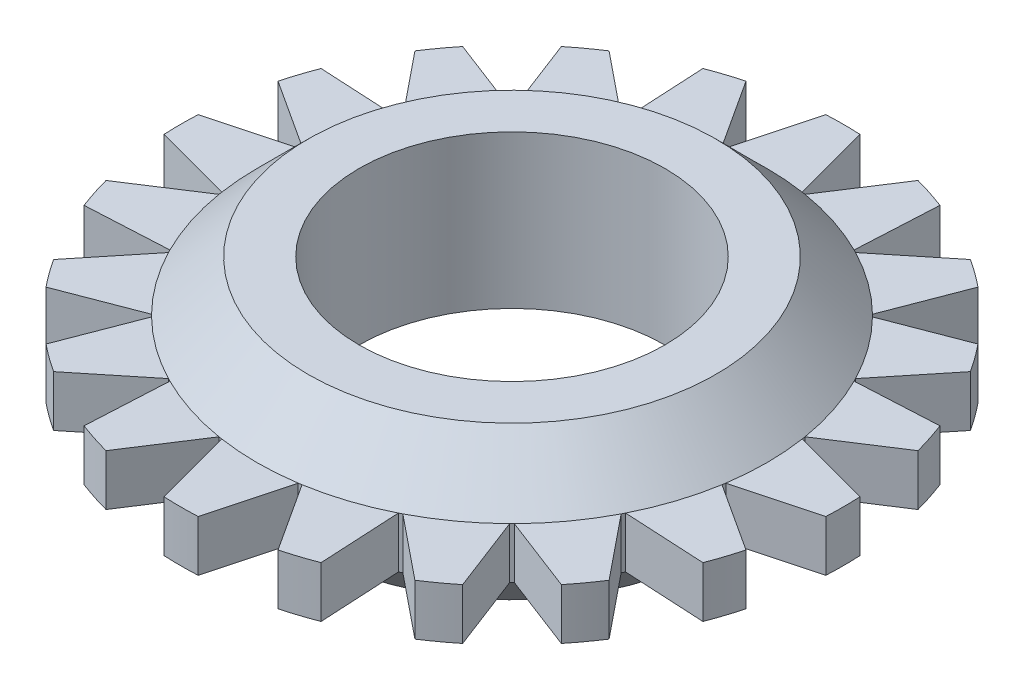
from build123d import *

# Parameters (mm, degrees)
EXTRUDE_1_DEPTH    = 5
EXTRUDE_1_2_DEPTH  = 5
EXTRUDE_1_3_DEPTH  = 5
EXTRUDE_1_4_DEPTH  = 5
EXTRUDE_1_5_DEPTH  = 5
EXTRUDE_1_6_DEPTH  = 5
EXTRUDE_1_7_DEPTH  = 5
EXTRUDE_1_8_DEPTH  = 5
EXTRUDE_1_9_DEPTH  = 5
EXTRUDE_1_10_DEPTH = 5
EXTRUDE_1_11_DEPTH = 5
EXTRUDE_1_12_DEPTH = 5
EXTRUDE_1_13_DEPTH = 5
EXTRUDE_1_14_DEPTH = 5
EXTRUDE_1_15_DEPTH = 5
EXTRUDE_1_16_DEPTH = 5
EXTRUDE_1_17_DEPTH = 5
EXTRUDE_1_18_DEPTH = 5
EXTRUDE_1_19_DEPTH = 5
EXTRUDE_1_20_DEPTH = 5
SKETCH_2_R         = 50
SKETCH_2_R_2       = 30
EXTRUDE_2_DEPTH    = 15
CHAMFER_1_SIZE     = 10


with BuildPart() as part:
    # 草图1 → 凸台-拉伸1 (new, symmetric)
    with BuildSketch(Plane(origin=(0, 0, 0), x_dir=(1, 0, 0), z_dir=(0, 1, 0))):
        with BuildLine():
            Line((-3.352362501, 64.91349371), (-7.5, 49.434299833))
            ThreePointArc((-7.5, 49.434299833), (0, 50), (7.5, 49.434299833))
            Line((7.5, 49.434299833), (3.352362501, 64.91349371))
            ThreePointArc((3.352362501, 64.91349371), (0, 65), (-3.352362501, 64.91349371))
        make_face()
    extrude(amount=EXTRUDE_1_DEPTH, both=True)



with BuildPart() as body_2:
    # 草图1 → Extrude 1 2 (new, symmetric)
    with BuildSketch(Plane(origin=(0, 0, 0), x_dir=(1, 0, 0), z_dir=(0, 1, 0))):
        with BuildLine():
            Line((16.871086519, 62.772338173), (8.143114881, 49.332440443))
            ThreePointArc((8.143114881, 49.332440443), (15.450849719, 47.552825815), (22.408962626, 44.697185527))
            Line((22.408962626, 44.697185527), (23.247658922, 60.700464204))
            ThreePointArc((23.247658922, 60.700464204), (20.086104634, 61.818673559), (16.871086519, 62.772338173))
        make_face()
    extrude(amount=EXTRUDE_1_2_DEPTH, both=True)


with BuildPart() as body_3:
    # 草图1 → Extrude 1 3 (new, symmetric)
    with BuildSketch(Plane(origin=(0, 0, 0), x_dir=(1, 0, 0), z_dir=(0, 1, 0))):
        with BuildLine():
            Line((35.443076043, 54.486588814), (22.989124942, 44.401578062))
            ThreePointArc((22.989124942, 44.401578062), (29.389262615, 40.450849719), (35.124379857, 35.584799278))
            Line((35.124379857, 35.584799278), (40.867312512, 50.545650337))
            ThreePointArc((40.867312512, 50.545650337), (38.206041399, 52.586104634), (35.443076043, 54.486588814))
        make_face()
    extrude(amount=EXTRUDE_1_3_DEPTH, both=True)


with BuildPart() as body_4:
    # 草图1 → Extrude 1 4 (new, symmetric)
    with BuildSketch(Plane(origin=(0, 0, 0), x_dir=(1, 0, 0), z_dir=(0, 1, 0))):
        with BuildLine():
            Line((50.545650337, 40.867312512), (35.584799278, 35.124379857))
            ThreePointArc((35.584799278, 35.124379857), (40.450849719, 29.389262615), (44.401578062, 22.989124942))
            Line((44.401578062, 22.989124942), (54.486588814, 35.443076043))
            ThreePointArc((54.486588814, 35.443076043), (52.586104634, 38.206041399), (50.545650337, 40.867312512))
        make_face()
    extrude(amount=EXTRUDE_1_4_DEPTH, both=True)


with BuildPart() as body_5:
    # 草图1 → Extrude 1 5 (new, symmetric)
    with BuildSketch(Plane(origin=(0, 0, 0), x_dir=(1, 0, 0), z_dir=(0, 1, 0))):
        with BuildLine():
            Line((60.700464204, 23.247658922), (44.697185527, 22.408962626))
            ThreePointArc((44.697185527, 22.408962626), (47.552825815, 15.450849719), (49.332440443, 8.143114881))
            Line((49.332440443, 8.143114881), (62.772338173, 16.871086519))
            ThreePointArc((62.772338173, 16.871086519), (61.818673559, 20.086104634), (60.700464204, 23.247658922))
        make_face()
    extrude(amount=EXTRUDE_1_5_DEPTH, both=True)


with BuildPart() as body_6:
    # 草图1 → Extrude 1 6 (new, symmetric)
    with BuildSketch(Plane(origin=(0, 0, 0), x_dir=(1, 0, 0), z_dir=(0, 1, 0))):
        with BuildLine():
            Line((64.91349371, 3.352362501), (49.434299833, 7.5))
            ThreePointArc((49.434299833, 7.5), (50, 0), (49.434299833, -7.5))
            Line((49.434299833, -7.5), (64.91349371, -3.352362501))
            ThreePointArc((64.91349371, -3.352362501), (65, 0), (64.91349371, 3.352362501))
        make_face()
    extrude(amount=EXTRUDE_1_6_DEPTH, both=True)


with BuildPart() as body_7:
    # 草图1 → Extrude 1 7 (new, symmetric)
    with BuildSketch(Plane(origin=(0, 0, 0), x_dir=(1, 0, 0), z_dir=(0, 1, 0))):
        with BuildLine():
            Line((62.772338173, -16.871086519), (49.332440443, -8.143114881))
            ThreePointArc((49.332440443, -8.143114881), (47.552825815, -15.450849719), (44.697185527, -22.408962626))
            Line((44.697185527, -22.408962626), (60.700464204, -23.247658922))
            ThreePointArc((60.700464204, -23.247658922), (61.818673559, -20.086104634), (62.772338173, -16.871086519))
        make_face()
    extrude(amount=EXTRUDE_1_7_DEPTH, both=True)


with BuildPart() as body_8:
    # 草图1 → Extrude 1 8 (new, symmetric)
    with BuildSketch(Plane(origin=(0, 0, 0), x_dir=(1, 0, 0), z_dir=(0, 1, 0))):
        with BuildLine():
            Line((54.486588814, -35.443076043), (44.401578062, -22.989124942))
            ThreePointArc((44.401578062, -22.989124942), (40.450849719, -29.389262615), (35.584799278, -35.124379857))
            Line((35.584799278, -35.124379857), (50.545650337, -40.867312512))
            ThreePointArc((50.545650337, -40.867312512), (52.586104634, -38.206041399), (54.486588814, -35.443076043))
        make_face()
    extrude(amount=EXTRUDE_1_8_DEPTH, both=True)


with BuildPart() as body_9:
    # 草图1 → Extrude 1 9 (new, symmetric)
    with BuildSketch(Plane(origin=(0, 0, 0), x_dir=(1, 0, 0), z_dir=(0, 1, 0))):
        with BuildLine():
            Line((40.867312512, -50.545650337), (35.124379857, -35.584799278))
            ThreePointArc((35.124379857, -35.584799278), (29.389262615, -40.450849719), (22.989124942, -44.401578062))
            Line((22.989124942, -44.401578062), (35.443076043, -54.486588814))
            ThreePointArc((35.443076043, -54.486588814), (38.206041399, -52.586104634), (40.867312512, -50.545650337))
        make_face()
    extrude(amount=EXTRUDE_1_9_DEPTH, both=True)


with BuildPart() as body_10:
    # 草图1 → Extrude 1 10 (new, symmetric)
    with BuildSketch(Plane(origin=(0, 0, 0), x_dir=(1, 0, 0), z_dir=(0, 1, 0))):
        with BuildLine():
            Line((23.247658922, -60.700464204), (22.408962626, -44.697185527))
            ThreePointArc((22.408962626, -44.697185527), (15.450849719, -47.552825815), (8.143114881, -49.332440443))
            Line((8.143114881, -49.332440443), (16.871086519, -62.772338173))
            ThreePointArc((16.871086519, -62.772338173), (20.086104634, -61.818673559), (23.247658922, -60.700464204))
        make_face()
    extrude(amount=EXTRUDE_1_10_DEPTH, both=True)


with BuildPart() as body_11:
    # 草图1 → Extrude 1 11 (new, symmetric)
    with BuildSketch(Plane(origin=(0, 0, 0), x_dir=(1, 0, 0), z_dir=(0, 1, 0))):
        with BuildLine():
            Line((3.352362501, -64.91349371), (7.5, -49.434299833))
            ThreePointArc((7.5, -49.434299833), (0, -50), (-7.5, -49.434299833))
            Line((-7.5, -49.434299833), (-3.352362501, -64.91349371))
            ThreePointArc((-3.352362501, -64.91349371), (0, -65), (3.352362501, -64.91349371))
        make_face()
    extrude(amount=EXTRUDE_1_11_DEPTH, both=True)


with BuildPart() as body_12:
    # 草图1 → Extrude 1 12 (new, symmetric)
    with BuildSketch(Plane(origin=(0, 0, 0), x_dir=(1, 0, 0), z_dir=(0, 1, 0))):
        with BuildLine():
            Line((-16.871086519, -62.772338173), (-8.143114881, -49.332440443))
            ThreePointArc((-8.143114881, -49.332440443), (-15.450849719, -47.552825815), (-22.408962626, -44.697185527))
            Line((-22.408962626, -44.697185527), (-23.247658922, -60.700464204))
            ThreePointArc((-23.247658922, -60.700464204), (-20.086104634, -61.818673559), (-16.871086519, -62.772338173))
        make_face()
    extrude(amount=EXTRUDE_1_12_DEPTH, both=True)


with BuildPart() as body_13:
    # 草图1 → Extrude 1 13 (new, symmetric)
    with BuildSketch(Plane(origin=(0, 0, 0), x_dir=(1, 0, 0), z_dir=(0, 1, 0))):
        with BuildLine():
            Line((-35.443076043, -54.486588814), (-22.989124942, -44.401578062))
            ThreePointArc((-22.989124942, -44.401578062), (-29.389262615, -40.450849719), (-35.124379857, -35.584799278))
            Line((-35.124379857, -35.584799278), (-40.867312512, -50.545650337))
            ThreePointArc((-40.867312512, -50.545650337), (-38.206041399, -52.586104634), (-35.443076043, -54.486588814))
        make_face()
    extrude(amount=EXTRUDE_1_13_DEPTH, both=True)


with BuildPart() as body_14:
    # 草图1 → Extrude 1 14 (new, symmetric)
    with BuildSketch(Plane(origin=(0, 0, 0), x_dir=(1, 0, 0), z_dir=(0, 1, 0))):
        with BuildLine():
            Line((-50.545650337, -40.867312512), (-35.584799278, -35.124379857))
            ThreePointArc((-35.584799278, -35.124379857), (-40.450849719, -29.389262615), (-44.401578062, -22.989124942))
            Line((-44.401578062, -22.989124942), (-54.486588814, -35.443076043))
            ThreePointArc((-54.486588814, -35.443076043), (-52.586104634, -38.206041399), (-50.545650337, -40.867312512))
        make_face()
    extrude(amount=EXTRUDE_1_14_DEPTH, both=True)


with BuildPart() as body_15:
    # 草图1 → Extrude 1 15 (new, symmetric)
    with BuildSketch(Plane(origin=(0, 0, 0), x_dir=(1, 0, 0), z_dir=(0, 1, 0))):
        with BuildLine():
            Line((-60.700464204, -23.247658922), (-44.697185527, -22.408962626))
            ThreePointArc((-44.697185527, -22.408962626), (-47.552825815, -15.450849719), (-49.332440443, -8.143114881))
            Line((-49.332440443, -8.143114881), (-62.772338173, -16.871086519))
            ThreePointArc((-62.772338173, -16.871086519), (-61.818673559, -20.086104634), (-60.700464204, -23.247658922))
        make_face()
    extrude(amount=EXTRUDE_1_15_DEPTH, both=True)


with BuildPart() as body_16:
    # 草图1 → Extrude 1 16 (new, symmetric)
    with BuildSketch(Plane(origin=(0, 0, 0), x_dir=(1, 0, 0), z_dir=(0, 1, 0))):
        with BuildLine():
            Line((-64.91349371, -3.352362501), (-49.434299833, -7.5))
            ThreePointArc((-49.434299833, -7.5), (-50, 0), (-49.434299833, 7.5))
            Line((-49.434299833, 7.5), (-64.91349371, 3.352362501))
            ThreePointArc((-64.91349371, 3.352362501), (-65, 0), (-64.91349371, -3.352362501))
        make_face()
    extrude(amount=EXTRUDE_1_16_DEPTH, both=True)


with BuildPart() as body_17:
    # 草图1 → Extrude 1 17 (new, symmetric)
    with BuildSketch(Plane(origin=(0, 0, 0), x_dir=(1, 0, 0), z_dir=(0, 1, 0))):
        with BuildLine():
            Line((-62.772338173, 16.871086519), (-49.332440443, 8.143114881))
            ThreePointArc((-49.332440443, 8.143114881), (-47.552825815, 15.450849719), (-44.697185527, 22.408962626))
            Line((-44.697185527, 22.408962626), (-60.700464204, 23.247658922))
            ThreePointArc((-60.700464204, 23.247658922), (-61.818673559, 20.086104634), (-62.772338173, 16.871086519))
        make_face()
    extrude(amount=EXTRUDE_1_17_DEPTH, both=True)


with BuildPart() as body_18:
    # 草图1 → Extrude 1 18 (new, symmetric)
    with BuildSketch(Plane(origin=(0, 0, 0), x_dir=(1, 0, 0), z_dir=(0, 1, 0))):
        with BuildLine():
            Line((-54.486588814, 35.443076043), (-44.401578062, 22.989124942))
            ThreePointArc((-44.401578062, 22.989124942), (-40.450849719, 29.389262615), (-35.584799278, 35.124379857))
            Line((-35.584799278, 35.124379857), (-50.545650337, 40.867312512))
            ThreePointArc((-50.545650337, 40.867312512), (-52.586104634, 38.206041399), (-54.486588814, 35.443076043))
        make_face()
    extrude(amount=EXTRUDE_1_18_DEPTH, both=True)


with BuildPart() as body_19:
    # 草图1 → Extrude 1 19 (new, symmetric)
    with BuildSketch(Plane(origin=(0, 0, 0), x_dir=(1, 0, 0), z_dir=(0, 1, 0))):
        with BuildLine():
            Line((-40.867312512, 50.545650337), (-35.124379857, 35.584799278))
            ThreePointArc((-35.124379857, 35.584799278), (-29.389262615, 40.450849719), (-22.989124942, 44.401578062))
            Line((-22.989124942, 44.401578062), (-35.443076043, 54.486588814))
            ThreePointArc((-35.443076043, 54.486588814), (-38.206041399, 52.586104634), (-40.867312512, 50.545650337))
        make_face()
    extrude(amount=EXTRUDE_1_19_DEPTH, both=True)


with BuildPart() as body_20:
    # 草图1 → Extrude 1 20 (new, symmetric)
    with BuildSketch(Plane(origin=(0, 0, 0), x_dir=(1, 0, 0), z_dir=(0, 1, 0))):
        with BuildLine():
            Line((-23.247658922, 60.700464204), (-22.408962626, 44.697185527))
            ThreePointArc((-22.408962626, 44.697185527), (-15.450849719, 47.552825815), (-8.143114881, 49.332440443))
            Line((-8.143114881, 49.332440443), (-16.871086519, 62.772338173))
            ThreePointArc((-16.871086519, 62.772338173), (-20.086104634, 61.818673559), (-23.247658922, 60.700464204))
        make_face()
    extrude(amount=EXTRUDE_1_20_DEPTH, both=True)


with BuildPart() as part_1:
    add(part.part)

    add(body_2.part)  # 凸台-拉伸2 merges body 2

    add(body_3.part)  # 凸台-拉伸2 merges body 3

    add(body_4.part)  # 凸台-拉伸2 merges body 4

    add(body_5.part)  # 凸台-拉伸2 merges body 5

    add(body_6.part)  # 凸台-拉伸2 merges body 6

    add(body_7.part)  # 凸台-拉伸2 merges body 7

    add(body_8.part)  # 凸台-拉伸2 merges body 8

    add(body_9.part)  # 凸台-拉伸2 merges body 9

    add(body_10.part)  # 凸台-拉伸2 merges body 10

    add(body_11.part)  # 凸台-拉伸2 merges body 11

    add(body_12.part)  # 凸台-拉伸2 merges body 12

    add(body_13.part)  # 凸台-拉伸2 merges body 13

    add(body_14.part)  # 凸台-拉伸2 merges body 14

    add(body_15.part)  # 凸台-拉伸2 merges body 15

    add(body_16.part)  # 凸台-拉伸2 merges body 16

    add(body_17.part)  # 凸台-拉伸2 merges body 17

    add(body_18.part)  # 凸台-拉伸2 merges body 18

    add(body_19.part)  # 凸台-拉伸2 merges body 19

    add(body_20.part)  # 凸台-拉伸2 merges body 20
    # 草图2 → 凸台-拉伸2 (add, symmetric)
    with BuildSketch(Plane(origin=(0, 0, 0), x_dir=(1, 0, 0), z_dir=(0, 1, 0))):
        with Locations(Location((0, 0, 0), (0, 0, 270))):
            Circle(SKETCH_2_R)
        with Locations(Location((0, 0, 0), (0, 0, 270))):
            Circle(SKETCH_2_R_2, mode=Mode.SUBTRACT)
    extrude(amount=EXTRUDE_2_DEPTH, both=True)

    # 倒角1
    chamfer_1_edges = [part_1.edges().sort_by_distance(p)[0] for p in [
        (0, 15, -50),
        (0, -15, -50),
    ]]
    chamfer(chamfer_1_edges, length=CHAMFER_1_SIZE - 0.0001)  # a hair under: the kernel refuses the full size


solid = part_1.part
